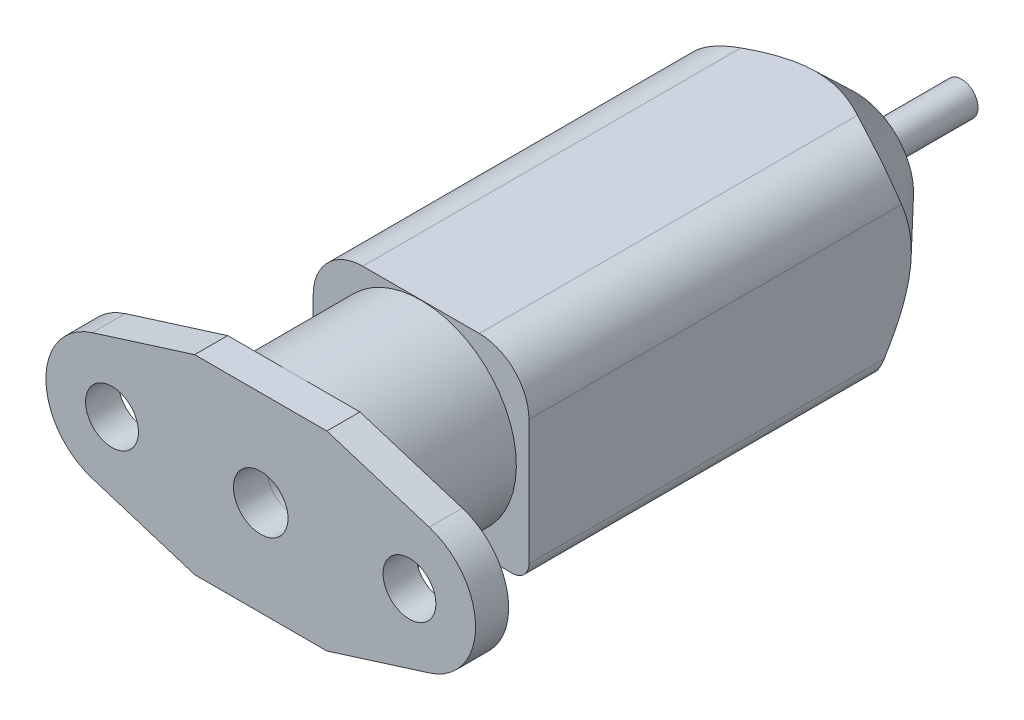
from build123d import *

# Parameters (mm, degrees)
CROQUIS1_R               = 1.598160281
CROQUIS1_R_2             = 1.600993429
CROQUIS1_R_3             = 1.650918845
SALIENTE_EXTRUIR7_DEPTH  = 2
CROQUIS2_R               = 5.764999893
CROQUIS2_R_2             = 1.651186543
SALIENTE_EXTRUIR8_DEPTH  = 7.7
SALIENTE_EXTRUIR9_DEPTH  = 26.3
CROQUIS6_R               = 0.999415005
SALIENTE_EXTRUIR10_DEPTH = 6.4


with BuildPart() as part:
    # Croquis1 → Saliente-Extruir7 (new body)
    with BuildSketch(Plane.XY):
        with BuildLine():
            Line((4.00000019, 5.763000809), (10.195969576, 3.8191034))
            ThreePointArc((10.195969576, 3.8191034), (12.999977706, 0.001566069), (10.197782, -3.817301838))
            Line((10.197782, -3.817301838), (4.00000019, -5.764999893))
            Line((4.00000019, -5.764999893), (-4.00000019, -5.764999893))
            Line((-4.00000019, -5.764999893), (-10.199065979, -3.817665654))
            ThreePointArc((-10.199065979, -3.817665654), (-13.000622723, -0.001109837), (-10.199143851, 3.815503142))
            Line((-10.199143851, 3.815503142), (-4.00000019, 5.763000809))
            Line((-4.00000019, 5.763000809), (4.00000019, 5.763000809))
        make_face()
        with Locations((8.997973452, 0.000616233)):
            Circle(CROQUIS1_R, mode=Mode.SUBTRACT)
        with Locations((-9.000145119, -0.001069025)):
            Circle(CROQUIS1_R_2, mode=Mode.SUBTRACT)
        Circle(CROQUIS1_R_3, mode=Mode.SUBTRACT)
    extrude(amount=-SALIENTE_EXTRUIR7_DEPTH)

    # Croquis2 → Saliente-Extruir8 (add)
    with BuildSketch(Plane(origin=(0, 0, -2), x_dir=(-1, 0, 0), z_dir=(0, 0, -1))):
        Circle(CROQUIS2_R)
        Circle(CROQUIS2_R_2, mode=Mode.SUBTRACT)
    extrude(amount=SALIENTE_EXTRUIR8_DEPTH)

    # Croquis3 → Saliente-Extruir9 (add)
    with BuildSketch(Plane(origin=(0, 0, -9.7), x_dir=(-1, 0, 0), z_dir=(0, 0, -1))):
        with BuildLine():
            Line((3.526868458, 5.783774708), (-3.526868458, 5.783774708))
            ThreePointArc((-3.526868458, 5.783774708), (-5.648188802, 4.905095052), (-6.526868458, 2.783774708))
            Line((-6.526868458, 2.783774708), (-6.526868458, -4.783774708))
            ThreePointArc((-6.526868458, -4.783774708), (-6.233975239, -5.490881489), (-5.526868458, -5.783774708))
            Line((-5.526868458, -5.783774708), (5.526868458, -5.783774708))
            ThreePointArc((5.526868458, -5.783774708), (6.233975239, -5.490881489), (6.526868458, -4.783774708))
            Line((6.526868458, -4.783774708), (6.526868458, 2.783774708))
            ThreePointArc((6.526868458, 2.783774708), (5.648188802, 4.905095052), (3.526868458, 5.783774708))
        make_face()
    extrude(amount=SALIENTE_EXTRUIR9_DEPTH)

    # Croquis5 → Cortar-Revolución1 (revolve, cut)
    with BuildSketch(Plane(origin=(0, 0, 0), x_dir=(1, 0, 0), z_dir=(0, 1, 0))):
        Polygon((-3.5, 36), (-8.472559386, 30.803521887), (-8.472559386, 36), align=None)
    revolve(axis=Axis((0, 0, -39.9199001), (0, 0, 1)), mode=Mode.SUBTRACT)

    # Croquis6 → Saliente-Extruir10 (add)
    with BuildSketch(Plane(origin=(0, 0, -36), x_dir=(-1, 0, 0), z_dir=(0, 0, -1))):
        Circle(CROQUIS6_R)
    extrude(amount=SALIENTE_EXTRUIR10_DEPTH)


solid = part.part
